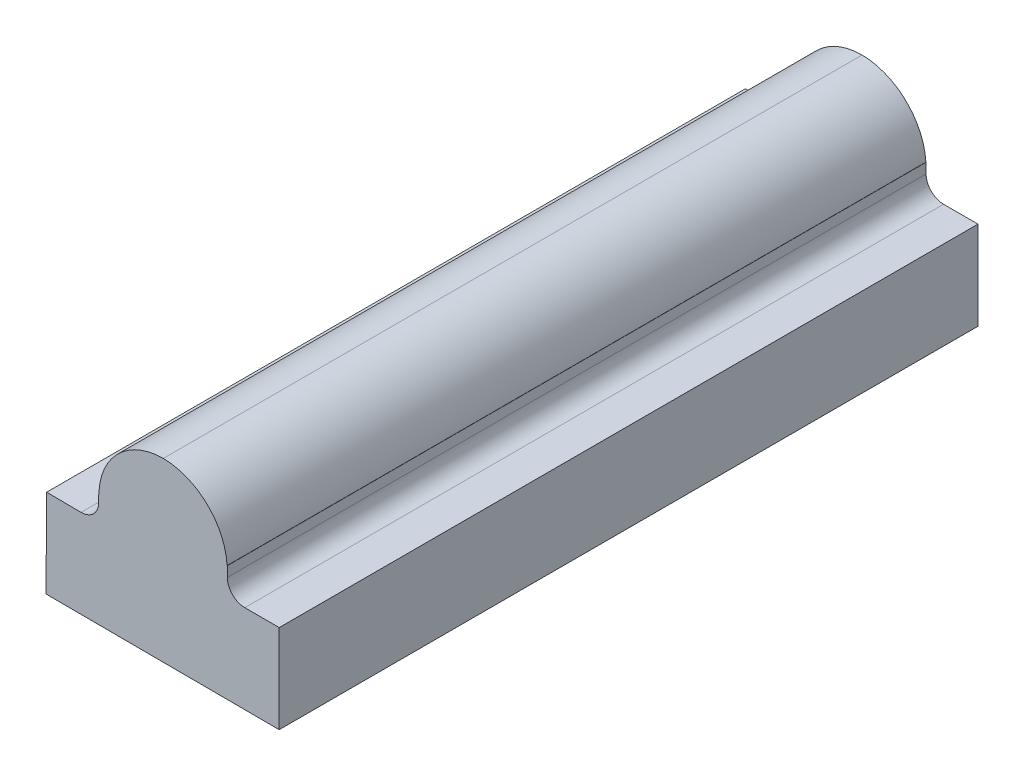
from build123d import *

# Parameters (mm, degrees)
BOSS_EXTRUDE1_START     = -3
BOSS_EXTRUDE1_DEPTH     = 6
CUT_EXTRUDE1_DEPTH      = 48.233441213
CUT_EXTRUDE1_DEPTH_BACK = 48.233441213


# Read off the part's stored shape, not the designer's step: Boss-Extrude1
with BuildPart() as part:
    # Boss-Extrude1 outline → Boss-Extrude1 (new body)
    with BuildSketch(Plane.XY.offset(BOSS_EXTRUDE1_START)):
        with BuildLine():
            ThreePointArc((-14.00696142, 43.286772628), (-14.17794226, 43.656035086), (-14.554858855, 43.809407478))
            Line((-14.554858855, 43.809407478), (-14.560076412, 42.536772628))
            Line((-14.560076412, 42.536772628), (-14.560076412, 42.289407478))
            Line((-14.560076412, 42.289407478), (-12.560077389, 42.289407478))
            Line((-12.560077389, 42.289407478), (-12.560077389, 42.699408687))
            Line((-12.560077389, 42.699408687), (-12.561019893, 42.699407886))
            Line((-12.561019893, 42.699407886), (-12.561019893, 43.809407886))
            ThreePointArc((-12.561019893, 43.809407886), (-12.952915394, 43.647400147), (-13.116017726, 43.255958938))
            Line((-13.116017726, 43.255958938), (-13.116017726, 43.253512386))
            ThreePointArc((-13.116017726, 43.253512386), (-13.115577754, 43.232295081), (-13.11432695, 43.211110107))
            ThreePointArc((-13.11432695, 43.211110107), (-13.153744256, 43.09756294), (-13.263870251, 43.049407478))
            Line((-13.263870251, 43.049407478), (-13.855076412, 43.049407478))
            ThreePointArc((-13.855076412, 43.049407478), (-13.961142429, 43.093341461), (-14.005076412, 43.199407478))
            Line((-14.005076412, 43.199407478), (-14.005076412, 43.286772628))
            Line((-14.005076412, 43.286772628), (-14.00696142, 43.286772628))
        make_face()
    boss_extrude1 = extrude(amount=BOSS_EXTRUDE1_DEPTH)

    # Mirror1: Boss-Extrude1 across plane
    add(boss_extrude1.mirror(Plane(origin=(-14.554858855, 43.809407478, 3), x_dir=(0, 0, 1), z_dir=(0.999991595899715, -0.004099771937727064, 0))))

    # Sketch2 → Cut-Extrude1 (cut, two sides: drawn at the far end of the back side and taken through both)
    with BuildSketch(Plane.XY.offset(3).offset(-CUT_EXTRUDE1_DEPTH_BACK)):
        Polygon((-15.556442519, 43.057594665), (-15.562070571, 42.297615265), (-13.560076901, 42.289407478), (-13.559473332, 43.049407478), (-13.559473332, 43.956069089), (-12.181780454, 43.956069089), (-12.181780454, 41.780834702), (-16.94397701, 41.941153484), (-16.798232662, 44.196547263), (-15.556442519, 43.988861567), align=None)
    extrude(amount=CUT_EXTRUDE1_DEPTH + CUT_EXTRUDE1_DEPTH_BACK, mode=Mode.SUBTRACT)


solid = part.part
